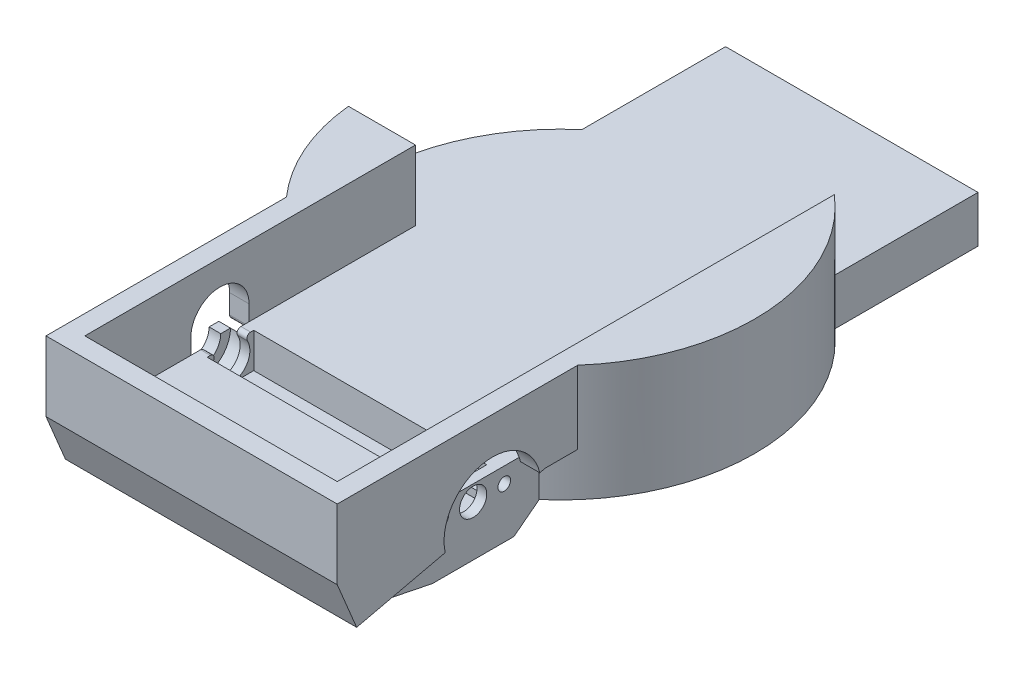
from build123d import *

# Parameters (mm, degrees)
SKETCH1_R                 = 50
BOSS_EXTRUDE1_DEPTH       = 30
SKETCH2_R                 = 4.4
BOSS_EXTRUDE2_DEPTH       = 10
SKETCH3_R                 = 7.5
SKETCH3_R_2               = 4.4
BOSS_EXTRUDE3_DEPTH       = 2
SKETCH4_W                 = 65
SKETCH4_H                 = 100
CUT_EXTRUDE1_DEPTH        = 18
SKETCH5_W                 = 65
SKETCH5_H                 = 12
BOSS_EXTRUDE4_DEPTH       = 40
BOSS_EXTRUDE5_REACH       = 117.758
BOSS_EXTRUDE5_END_RADIUS  = 50
SKETCH6_W                 = 65
SKETCH6_H                 = 12
SKETCH7_W                 = 60
SKETCH7_H                 = 12
CUT_EXTRUDE2_DEPTH        = 9
SKETCH9_R                 = 3.5
CUT_EXTRUDE4_DEPTH        = 2.5
BOSS_EXTRUDE6_DEPTH       = 4
BOSS_EXTRUDE7_DEPTH       = 4
SKETCH15_R                = 5
CUT_EXTRUDE7_DEPTH        = 2.5
SKETCH11_R                = 1.625
CUT_EXTRUDE8_DEPTH        = 5
CUT_EXTRUDE9_DEPTH        = 17
CUT_EXTRUDE9_DEPTH_BACK   = 5
SKETCH16_W                = 8
SKETCH16_H                = 5
SKETCH17_W                = 73
SKETCH17_H                = 21
BOSS_EXTRUDE8_DEPTH       = 5
BOSS_EXTRUDE9_DEPTH       = 65
BOSS_EXTRUDE10_DEPTH      = 8
FILLET2_R                 = 1
SKETCH20_W                = 65
SKETCH20_H                = 5
BOSS_EXTRUDE11_DEPTH      = 18
BOSS_EXTRUDE12_DEPTH      = 65
SKETCH23_W                = 65
SKETCH23_H                = 12
BOSS_EXTRUDE13_DEPTH      = 25
BOSS_EXTRUDE14_REACH      = 158.285
BOSS_EXTRUDE14_END_RADIUS = 50
SKETCH24_W                = 65
SKETCH24_H                = 12
BOSS_EXTRUDE19_DEPTH      = 5
BOSS_EXTRUDE20_REACH      = 132.155
BOSS_EXTRUDE20_END_RADIUS = 50
SKETCH26_W                = 5
SKETCH26_H                = 18.776858115
SKETCH27_R                = 12.5
CUT_EXTRUDE10_DEPTH       = 5
BOSS_EXTRUDE23_DEPTH      = 5
BOSS_EXTRUDE24_REACH      = 134.185
BOSS_EXTRUDE24_END_RADIUS = 50
SKETCH29_W                = 5
SKETCH29_H                = 19.299681274
SKETCH30_R                = 7.5
CUT_EXTRUDE11_DEPTH       = 5
CUT_EXTRUDE14_DEPTH       = 5
FILLET4_R                 = 1
SKETCH35_W                = 42.8529271
SKETCH35_H                = 18
CUT_EXTRUDE15_DEPTH       = 130.349333203


with BuildPart() as part:
    # Sketch1 → Boss-Extrude1 (new body)
    with BuildSketch(Plane(origin=(0, 0, 0), x_dir=(1, 0, 0), z_dir=(0, 1, 0))):
        with Locations(Location((0, 0, 0), (0, 0, 270))):
            Circle(SKETCH1_R)
    extrude(amount=BOSS_EXTRUDE1_DEPTH)

    # Sketch2 → Boss-Extrude2 (add)
    with BuildSketch(Plane.XZ):
        with Locations(Location((0, 0, 0), (0, 0, 90))):
            Circle(SKETCH2_R)
        with BuildLine():
            Line((-2, -1.5), (-2, 1.5))
            ThreePointArc((-2, 1.5), (2.5, 0), (-2, -1.5))
        make_face(mode=Mode.SUBTRACT)
    extrude(amount=BOSS_EXTRUDE2_DEPTH)

    # Sketch3 → Boss-Extrude3 (add)
    with BuildSketch(Plane.XZ):
        with Locations(Location((0, 0, 0), (0, 0, 90))):
            Circle(SKETCH3_R)
        with Locations(Location((0, 0, 0), (0, 0, 270))):
            Circle(SKETCH3_R_2, mode=Mode.SUBTRACT)
    extrude(amount=BOSS_EXTRUDE3_DEPTH)

    # Sketch4 → Cut-Extrude1 (cut)
    with BuildSketch(Plane(origin=(0, 30, 0), x_dir=(1, 0, 0), z_dir=(0, 1, 0))):
        Rectangle(SKETCH4_W, SKETCH4_H)
    extrude(amount=-CUT_EXTRUDE1_DEPTH, mode=Mode.SUBTRACT)



with BuildPart() as body_2:
    # Sketch5 → Boss-Extrude4 (new body)
    with BuildSketch(Plane(origin=(0, 12, 50), x_dir=(1, 0, 0), z_dir=(0, 0, 1))):
        with Locations((0, -6)):
            Rectangle(SKETCH5_W, SKETCH5_H)
    extrude(amount=BOSS_EXTRUDE4_DEPTH)


with BuildPart() as part_1:
    add(part.part)

    add(body_2.part)  # Boss-Extrude5 merges body 2
    # Boss-Extrude5: up to this cylinder (the profile starts outside it)
    boss_extrude5_end = Plane(origin=(0, 6, 0), z_dir=(0, -1, 0)) * Cylinder(BOSS_EXTRUDE5_END_RADIUS, 336.516, mode=Mode.PRIVATE)
    # Sketch6 → Boss-Extrude5 (add, up to the surface)
    with BuildSketch(Plane(origin=(0, 0, 50), x_dir=(-1, 0, 0), z_dir=(0, 0, -1)), mode=Mode.PRIVATE) as boss_extrude5_sk1:
        with Locations((0, 6)):
            Rectangle(SKETCH6_W, SKETCH6_H)
    boss_extrude5_tool1 = extrude(boss_extrude5_sk1.sketch, amount=BOSS_EXTRUDE5_REACH, mode=Mode.PRIVATE) - boss_extrude5_end
    add(boss_extrude5_tool1.solids().sort_by_distance((0, 6, 50))[0])
    add(boss_extrude5_tool1.solids().sort_by_distance((0, 6, 50))[1])

    # Sketch7 → Cut-Extrude2 (cut)
    with BuildSketch(Plane(origin=(0, 12, 0), x_dir=(1, 0, 0), z_dir=(0, 1, 0))):
        with Locations((0, -55)):
            Rectangle(SKETCH7_W, SKETCH7_H)
    extrude(amount=-CUT_EXTRUDE2_DEPTH, mode=Mode.SUBTRACT)

    # Sketch9 → Cut-Extrude4 (cut)
    with BuildSketch(Plane.ZY.offset(-30)):
        with Locations((55, 8)):
            Circle(SKETCH9_R)
    extrude(amount=-CUT_EXTRUDE4_DEPTH, mode=Mode.SUBTRACT)

    # Sketch13 → Boss-Extrude6 (add)
    with BuildSketch(Plane.ZY.offset(32.5)):
        with BuildLine():
            Line((39.5, 0), (47.5, 0))
            Line((47.5, 0), (62.5, 0))
            Line((62.5, 0), (70.5, 0))
            Line((70.5, 0), (62.5, 8))
            ThreePointArc((62.5, 8), (55, 0.5), (47.5, 8))
            Line((47.5, 8), (39.5, 0))
        make_face()
    extrude(amount=BOSS_EXTRUDE6_DEPTH)

    # Sketch14 → Boss-Extrude7 (add)
    with BuildSketch(Plane.ZY.offset(36.5)):
        with BuildLine():
            Line((39.5, 0), (47.5, 8))
            Line((47.5, 8), (50, 8))
            ThreePointArc((50, 8), (55, 3), (60, 8))
            Line((60, 8), (62.5, 8))
            Line((62.5, 8), (70.5, 0))
            Line((70.5, 0), (39.5, 0))
        make_face()
    extrude(amount=BOSS_EXTRUDE7_DEPTH)

    # Sketch15 → Cut-Extrude7 (cut)
    with BuildSketch(Plane(origin=(-30, 0, 0), x_dir=(0, 0, -1), z_dir=(1, 0, 0))):
        with Locations((-55, 8)):
            Circle(SKETCH15_R)
    extrude(amount=-CUT_EXTRUDE7_DEPTH, mode=Mode.SUBTRACT)

    # Sketch11 → Cut-Extrude8 (cut)
    with BuildSketch(Plane(origin=(32.5, 0, 0), x_dir=(0, 0, -1), z_dir=(1, 0, 0))):
        with Locations((-63, 8)):
            Circle(SKETCH11_R)
        with Locations((-47, 8)):
            Circle(SKETCH11_R)
    extrude(amount=-CUT_EXTRUDE8_DEPTH, mode=Mode.SUBTRACT)

    # Sketch16 → Cut-Extrude9 (cut, two sides: drawn at the far end of the back side and taken through both)
    with BuildSketch(Plane.XY.offset(49).offset(-CUT_EXTRUDE9_DEPTH_BACK)):
        with Locations((26, 7.5)):
            Rectangle(SKETCH16_W, SKETCH16_H)
    extrude(amount=CUT_EXTRUDE9_DEPTH + CUT_EXTRUDE9_DEPTH_BACK, mode=Mode.SUBTRACT)

    # Sketch17 → Boss-Extrude8 (add)
    with BuildSketch(Plane.XZ):
        with Locations((-4, 55)):
            Rectangle(SKETCH17_W, SKETCH17_H)
    extrude(amount=BOSS_EXTRUDE8_DEPTH)

    # Sketch18 → Boss-Extrude9 (add)
    with BuildSketch(Plane(origin=(32.5, 0, 0), x_dir=(0, 0, -1), z_dir=(1, 0, 0))):
        Polygon((-65.5, -5), (-90, 0), (-65.5, 0), align=None)
        Polygon((-44.5, -5), (-44.5, 0), (-37.996710384, 0), align=None)
    extrude(amount=-BOSS_EXTRUDE9_DEPTH)

    # Sketch19 → Boss-Extrude10 (add)
    with BuildSketch(Plane.ZY.offset(40.5)):
        Polygon((65.5, -5), (70.5, 0), (65.5, 0), align=None)
        Polygon((44.5, -5), (39.5, 0), (44.5, 0), align=None)
    extrude(amount=-BOSS_EXTRUDE10_DEPTH)

    # Fillet2
    fillet2_edges = [part_1.edges().sort_by_distance(p)[0] for p in [
        (-31.25, 12, 58),
        (-31.25, 12, 52),
    ]]
    fillet(fillet2_edges, radius=FILLET2_R)



with BuildPart() as body_2_2:
    # Sketch20 → Boss-Extrude11 (new body)
    with BuildSketch(Plane(origin=(0, 12, 0), x_dir=(1, 0, 0), z_dir=(0, 1, 0))):
        with Locations((0, -92.5)):
            Rectangle(SKETCH20_W, SKETCH20_H)
    extrude(amount=BOSS_EXTRUDE11_DEPTH)


with BuildPart() as part_2:
    add(part_1.part)

    add(body_2_2.part)  # Boss-Extrude12 merges body 2 2
    # Sketch22 → Boss-Extrude12 (add)
    with BuildSketch(Plane(origin=(32.5, 0, 0), x_dir=(0, 0, -1), z_dir=(1, 0, 0))):
        Polygon((-95, 12), (-90, 0), (-90, 12), align=None)
    extrude(amount=-BOSS_EXTRUDE12_DEPTH)



with BuildPart() as body_2_3:
    # Sketch23 → Boss-Extrude13 (new body)
    with BuildSketch(Plane(origin=(0, 12, -50), x_dir=(-1, 0, 0), z_dir=(0, 0, -1))):
        with Locations((0, -6)):
            Rectangle(SKETCH23_W, SKETCH23_H)
    extrude(amount=BOSS_EXTRUDE13_DEPTH)


with BuildPart() as part_3:
    add(part_2.part)

    add(body_2_3.part)  # Boss-Extrude14 merges body 2 3
    # Boss-Extrude14: up to this cylinder (the profile starts outside it)
    boss_extrude14_end = Plane(origin=(0, 6, 0), z_dir=(0, -1, 0)) * Cylinder(BOSS_EXTRUDE14_END_RADIUS, 417.57, mode=Mode.PRIVATE)
    # Sketch24 → Boss-Extrude14 (add, up to the surface)
    with BuildSketch(Plane.XY.offset(-50), mode=Mode.PRIVATE) as boss_extrude14_sk1:
        with Locations((0, 6)):
            Rectangle(SKETCH24_W, SKETCH24_H)
    boss_extrude14_tool1 = extrude(boss_extrude14_sk1.sketch, amount=BOSS_EXTRUDE14_REACH, mode=Mode.PRIVATE) - boss_extrude14_end
    add(boss_extrude14_tool1.solids().sort_by_distance((0, 6, -50))[0])
    add(boss_extrude14_tool1.solids().sort_by_distance((0, 6, -50))[1])

    # Sketch25 → Boss-Extrude19 (add)
    with BuildSketch(Plane(origin=(32.5, 0, 0), x_dir=(0, 0, -1), z_dir=(1, 0, 0))):
        Polygon((-95, 30), (-95, 12), (-90, 0), (-41.363308514, 11.223141885), (-41.363308514, 30), align=None)
    extrude(amount=BOSS_EXTRUDE19_DEPTH)

    # Boss-Extrude20: up to this cylinder (the profile starts outside it)
    boss_extrude20_end = Plane(origin=(0, 20.611571, 0), z_dir=(0, -1, 0)) * Cylinder(BOSS_EXTRUDE20_END_RADIUS, 365.31, mode=Mode.PRIVATE)
    # Sketch26 → Boss-Extrude20 (add, up to the surface)
    with BuildSketch(Plane(origin=(0, 0, 41.363308514), x_dir=(-1, 0, 0), z_dir=(0, 0, -1)), mode=Mode.PRIVATE) as boss_extrude20_sk1:
        with Locations((-35, 20.611570943)):
            Rectangle(SKETCH26_W, SKETCH26_H)
    boss_extrude20_tool1 = extrude(boss_extrude20_sk1.sketch, amount=BOSS_EXTRUDE20_REACH, mode=Mode.PRIVATE) - boss_extrude20_end
    add(boss_extrude20_tool1.solids().sort_by_distance((35, 20.611571, 41.363309))[0])

    # Sketch27 → Cut-Extrude10 (cut)
    with BuildSketch(Plane(origin=(32.5, 0, 0), x_dir=(0, 0, -1), z_dir=(1, 0, 0))):
        with Locations((-55, 8)):
            Circle(SKETCH27_R)
    extrude(amount=CUT_EXTRUDE10_DEPTH, mode=Mode.SUBTRACT)

    # Sketch28 → Boss-Extrude23 (add)
    with BuildSketch(Plane.ZY.offset(32.5)):
        Polygon((95, 30), (43.629018859, 30), (43.629018859, 10.700318726), (90, 0), (95, 12), align=None)
    extrude(amount=BOSS_EXTRUDE23_DEPTH)

    # Boss-Extrude24: up to this cylinder (the profile starts outside it)
    boss_extrude24_end = Plane(origin=(0, 20.350159, 0), z_dir=(0, -1, 0)) * Cylinder(BOSS_EXTRUDE24_END_RADIUS, 369.37, mode=Mode.PRIVATE)
    # Sketch29 → Boss-Extrude24 (add, up to the surface)
    with BuildSketch(Plane(origin=(0, 0, 43.629018859), x_dir=(-1, 0, 0), z_dir=(0, 0, -1)), mode=Mode.PRIVATE) as boss_extrude24_sk1:
        with Locations((35, 20.350159363)):
            Rectangle(SKETCH29_W, SKETCH29_H)
    boss_extrude24_tool1 = extrude(boss_extrude24_sk1.sketch, amount=BOSS_EXTRUDE24_REACH, mode=Mode.PRIVATE) - boss_extrude24_end
    add(boss_extrude24_tool1.solids().sort_by_distance((-35, 20.350159, 43.629019))[0])

    # Sketch30 → Cut-Extrude11 (cut)
    with BuildSketch(Plane.ZY.offset(32.5)):
        with Locations((55, 8)):
            Circle(SKETCH30_R)
    extrude(amount=CUT_EXTRUDE11_DEPTH, mode=Mode.SUBTRACT)

    # Sketch32 → Cut-Extrude14 (cut)
    with BuildSketch(Plane.ZY.offset(37.5)):
        with BuildLine():
            Line((47.709143816, 9.75881099), (47.709143816, 15.997265712))
            ThreePointArc((47.709143816, 15.997265712), (55.209143816, 23.497265712), (62.709143816, 15.997265712))
            Line((62.709143816, 15.997265712), (62.709143816, 9.75881099))
            Line((62.709143816, 9.75881099), (47.709143816, 9.75881099))
        make_face()
    extrude(amount=-CUT_EXTRUDE14_DEPTH, mode=Mode.SUBTRACT)

    # Fillet4
    # the kernel refuses this fillet: 1 mm, written as the material it takes off along each edge
    with BuildSketch(Plane(origin=(-39.574233457, 9.75881099, 62.290856184), x_dir=(0, 0, 1), z_dir=(1, 0, 0))) as fillet4_piece_1:
        with BuildLine():
            CenterArc((1.141727679, 0.690387208), FILLET4_R, 172.778996455, 50.881771072)
            Line((0.14965899, 0.816084123), (0.129817616, 0.818598062))
            ThreePointArc((0.129817616, 0.818598062), (0.066451188, 0.409578532), (-0.019442283, 0.004690163))
            Line((-0.019442283, 0.004690163), (0, -0.02))
            ThreePointArc((0, -0.02), (0.209143816, -0.02), (0.40381883, -0.013807744))
            Line((0.40381883, -0.013807744), (0.418287631, 0))
        make_face()
    extrude(amount=7.074233457, mode=Mode.SUBTRACT)
    with BuildSketch(Plane(origin=(-40.642583004, 9.75881099, 47.709143816), x_dir=(0, 0.22484600170345923, -0.9743943121334238), z_dir=(1, 0, 0))) as fillet4_piece_2:
        with BuildLine():
            CenterArc((FILLET4_R * 1.2570332015, FILLET4_R), FILLET4_R, 167.006177322, 102.993822678)
            Line((FILLET4_R * 0.282638889366, FILLET4_R * 1.2248460017), (FILLET4_R * 0.263151003123, FILLET4_R * 1.22934292174))
            Line((FILLET4_R * 0.263151003123, FILLET4_R * 1.22934292174), (-FILLET4_R * 0.02514066403, -FILLET4_R * 0.02))
            Line((-FILLET4_R * 0.02514066403, -FILLET4_R * 0.02), (FILLET4_R * 1.2570332015, -FILLET4_R * 0.02))
            Line((FILLET4_R * 1.2570332015, -FILLET4_R * 0.02), (FILLET4_R * 1.2570332015, 0))
        make_face()
    extrude(amount=8.142583004, mode=Mode.SUBTRACT)

    # Sketch35 → Cut-Extrude15 (cut, through all)
    with BuildSketch(Plane(origin=(-32.5, 0, 0), x_dir=(0, 0, -1), z_dir=(1, 0, 0))):
        with Locations((16.570246834, 21)):
            Rectangle(SKETCH35_W, SKETCH35_H)
    extrude(amount=-CUT_EXTRUDE15_DEPTH, mode=Mode.SUBTRACT)


solid = part_3.part
